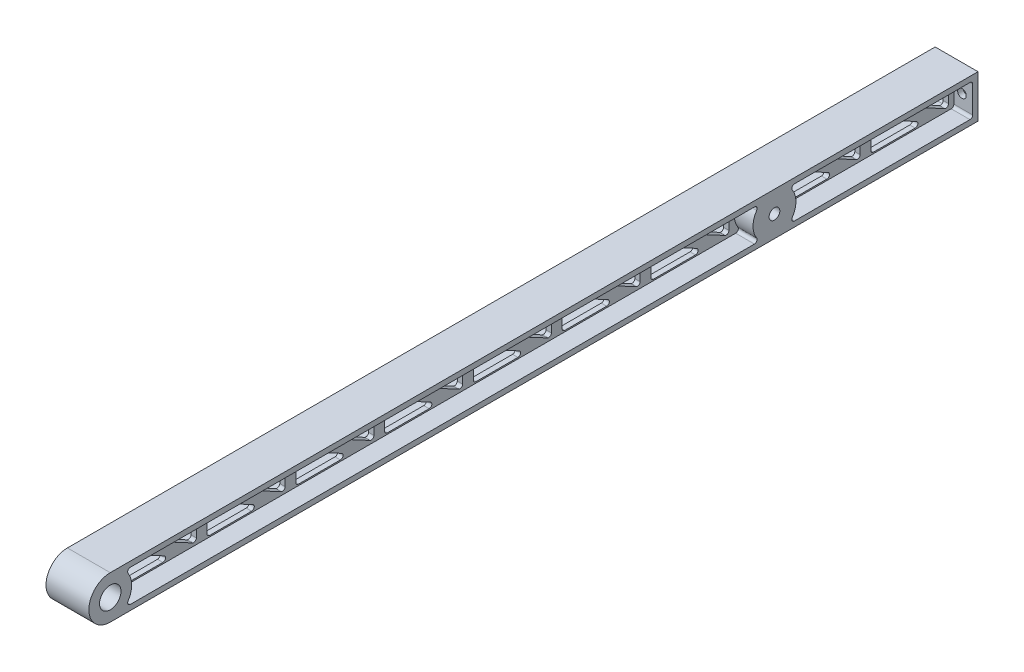
from build123d import *

# Parameters (mm, degrees)
SKETCH1_R                   = 6.35
BOSS_EXTRUDE1_DEPTH         = 25.4
F_1_4_20_TAPPED_HOLE1_D     = 5.1054
F_1_4_20_TAPPED_HOLE1_DEPTH = 16.51
F_1_4_20_TAPPED_HOLE1_TIP   = 1.533816902
SKETCH4_R                   = 3.175
CUT_EXTRUDE1_DEPTH          = 38.1
CUT_EXTRUDE2_START          = -11.1125
CUT_EXTRUDE2_DEPTH          = 11.1125
CUT_EXTRUDE3_DEPTH          = 515.705105042
FILLET2_R                   = 1.5875


with BuildPart() as part:
    # Sketch1 → Boss-Extrude1 (new body)
    with BuildSketch(Plane(origin=(0, 0, 0), x_dir=(0, 0, -1), z_dir=(1, 0, 0))):
        with BuildLine():
            Line((0, 12.7), (514.35, 12.7))
            Line((514.35, 12.7), (514.35, -12.7))
            Line((514.35, -12.7), (0, -12.7))
            ThreePointArc((0, -12.7), (-12.7, 0), (0, 12.7))
        make_face()
        Circle(SKETCH1_R, mode=Mode.SUBTRACT)
    extrude(amount=BOSS_EXTRUDE1_DEPTH)

    # 1/4-20 Tapped Hole1
    with Locations(Plane(origin=(0, 0, -514.35), x_dir=(-1, 0, 0), z_dir=(0, 0, -1))):
        with Locations((-6.35, 0), (-19.05, 0)):
            Hole(F_1_4_20_TAPPED_HOLE1_D / 2, depth=F_1_4_20_TAPPED_HOLE1_DEPTH)
            with Locations((0, 0, -(F_1_4_20_TAPPED_HOLE1_DEPTH + F_1_4_20_TAPPED_HOLE1_TIP / 2))):  # 118° drill point
                Cone(0, F_1_4_20_TAPPED_HOLE1_D / 2, F_1_4_20_TAPPED_HOLE1_TIP, mode=Mode.SUBTRACT)

    # Sketch4 → Cut-Extrude1 (cut)
    with BuildSketch(Plane(origin=(25.4, 0, 0), x_dir=(0, 0, -1), z_dir=(1, 0, 0))):
        with Locations((393.7, 0)):
            Circle(SKETCH4_R)
    extrude(amount=-CUT_EXTRUDE1_DEPTH, mode=Mode.SUBTRACT)

    # Sketch19 → Cut-Extrude2 (cut)
    with BuildSketch(Plane(origin=(25.4, 0, 0), x_dir=(0, 0, -1), z_dir=(1, 0, 0)).offset(CUT_EXTRUDE2_START)):
        with BuildLine():
            Line((385.299739587, 9.525), (8.400260413, 9.525))
            ThreePointArc((8.400260413, 9.525), (12.7, 0), (8.400260413, -9.525))
            Line((8.400260413, -9.525), (385.299739587, -9.525))
            ThreePointArc((385.299739587, -9.525), (381, 0), (385.299739587, 9.525))
        make_face()
        with BuildLine():
            Line((511.175, 9.525), (402.100260413, 9.525))
            ThreePointArc((402.100260413, 9.525), (406.4, 0), (402.100260413, -9.525))
            Line((402.100260413, -9.525), (511.175, -9.525))
            Line((511.175, -9.525), (511.175, 9.525))
        make_face()
    cut_extrude2 = extrude(amount=CUT_EXTRUDE2_DEPTH, mode=Mode.SUBTRACT)

    # Sketch21 → Cut-Extrude3 (cut, through all)
    with BuildSketch(Plane(origin=(14.2875, 0, 0), x_dir=(0, 0, -1), z_dir=(1, 0, 0))):
        Polygon((48.63864913, -8.73125), (15.875, 8.73125), (15.875, -8.73125), align=None)
        Polygon((62.139285714, 8.73125), (29.375636584, 8.73125), (62.139285714, -8.73125), align=None)
        Polygon((101.252934844, -8.73125), (68.489285714, 8.73125), (68.489285714, -8.73125), align=None)
        Polygon((114.753571429, 8.73125), (81.989922298, 8.73125), (114.753571429, -8.73125), align=None)
        Polygon((153.867220559, -8.73125), (121.103571429, 8.73125), (121.103571429, -8.73125), align=None)
        Polygon((167.367857143, 8.73125), (134.604208013, 8.73125), (167.367857143, -8.73125), align=None)
        Polygon((206.481506273, -8.73125), (173.717857143, 8.73125), (173.717857143, -8.73125), align=None)
        Polygon((219.982142857, 8.73125), (187.218493727, 8.73125), (219.982142857, -8.73125), align=None)
        Polygon((259.095791987, -8.73125), (226.332142857, 8.73125), (226.332142857, -8.73125), align=None)
        Polygon((272.596428571, 8.73125), (239.832779441, 8.73125), (272.596428571, -8.73125), align=None)
        Polygon((311.710077702, -8.73125), (278.946428571, 8.73125), (278.946428571, -8.73125), align=None)
        Polygon((325.210714286, 8.73125), (292.447065156, 8.73125), (325.210714286, -8.73125), align=None)
        Polygon((364.324363416, -8.73125), (331.560714286, 8.73125), (331.560714286, -8.73125), align=None)
        Polygon((377.825, 8.73125), (345.06135087, 8.73125), (377.825, -8.73125), align=None)
        Polygon((442.166934829, -8.73125), (409.575, 8.73125), (409.575, -8.73125), align=None)
        Polygon((423.020565171, 8.73125), (455.6125, -8.73125), (455.6125, 8.73125), align=None)
        Polygon((494.554434829, -8.73125), (461.9625, 8.73125), (461.9625, -8.73125), align=None)
        Polygon((475.408065171, 8.73125), (508, -8.73125), (508, 8.73125), align=None)
    extrude(amount=-CUT_EXTRUDE3_DEPTH, mode=Mode.SUBTRACT)

    # Mirror2: Cut-Extrude2 across plane
    add(cut_extrude2.mirror(Plane.ZY.offset(-12.7)), mode=Mode.SUBTRACT)

    # Fillet2
    fillet2_edges = [part.edges().sort_by_distance(p)[0] for p in [
        (12.7, 8.73125, -15.875),
        (12.7, -8.73125, -48.63864913),
        (12.7, 8.73125, -62.139285714),
        (12.7, -8.73125, -62.139285714),
        (12.7, 8.73125, -29.375636584),
        (12.7, -8.73125, -121.103571429),
        (12.7, 8.73125, -121.103571429),
        (12.7, -8.73125, -153.867220559),
        (12.7, 8.73125, -167.367857143),
        (12.7, -8.73125, -167.367857143),
        (12.7, 8.73125, -134.604208013),
        (12.7, -8.73125, -226.332142857),
        (12.7, 8.73125, -226.332142857),
        (12.7, -8.73125, -259.095791987),
        (12.7, 8.73125, -272.596428571),
        (12.7, -8.73125, -272.596428571),
        (12.7, 8.73125, -239.832779441),
        (12.7, -8.73125, -331.560714286),
        (12.7, 8.73125, -331.560714286),
        (12.7, -8.73125, -364.324363416),
        (12.7, 8.73125, -377.825),
        (12.7, -8.73125, -377.825),
        (12.7, 8.73125, -345.06135087),
        (12.7, 8.73125, -325.210714286),
        (12.7, -8.73125, -325.210714286),
        (12.7, 8.73125, -292.447065156),
        (12.7, -8.73125, -278.946428571),
        (12.7, 8.73125, -278.946428571),
        (12.7, -8.73125, -311.710077702),
        (12.7, 8.73125, -219.982142857),
        (12.7, -8.73125, -219.982142857),
        (12.7, 8.73125, -187.218493727),
        (12.7, -8.73125, -173.717857143),
        (12.7, 8.73125, -173.717857143),
        (12.7, -8.73125, -206.481506273),
        (12.7, 8.73125, -114.753571429),
        (12.7, -8.73125, -114.753571429),
        (12.7, 8.73125, -81.989922298),
        (12.7, -8.73125, -68.489285714),
        (12.7, 8.73125, -68.489285714),
        (12.7, -8.73125, -101.252934844),
        (12.7, -8.73125, -15.875),
        (5.55625, -9.525, -385.299739587),
        (5.55625, 9.525, -8.400260413),
        (5.55625, 9.525, -385.299739587),
        (5.55625, 9.525, -402.100260413),
        (5.55625, 9.525, -511.175),
        (5.55625, -9.525, -511.175),
        (5.55625, -9.525, -402.100260413),
        (5.55625, -9.525, -8.400260413),
        (19.84375, -9.525, -402.100260413),
        (19.84375, -9.525, -511.175),
        (19.84375, 9.525, -511.175),
        (19.84375, 9.525, -402.100260413),
        (19.84375, 9.525, -385.299739587),
        (19.84375, 9.525, -8.400260413),
        (19.84375, -9.525, -385.299739587),
        (19.84375, -9.525, -8.400260413),
        (12.7, 8.73125, -409.575),
        (12.7, -8.73125, -442.166934829),
        (12.7, -8.73125, -461.9625),
        (12.7, 8.73125, -461.9625),
        (12.7, -8.73125, -494.554434829),
        (12.7, -8.73125, -508),
        (12.7, 8.73125, -475.408065171),
        (12.7, 8.73125, -508),
        (12.7, -8.73125, -455.6125),
        (12.7, 8.73125, -423.020565171),
        (12.7, 8.73125, -455.6125),
        (12.7, -8.73125, -409.575),
    ]]
    fillet(fillet2_edges, radius=FILLET2_R)


solid = part.part
